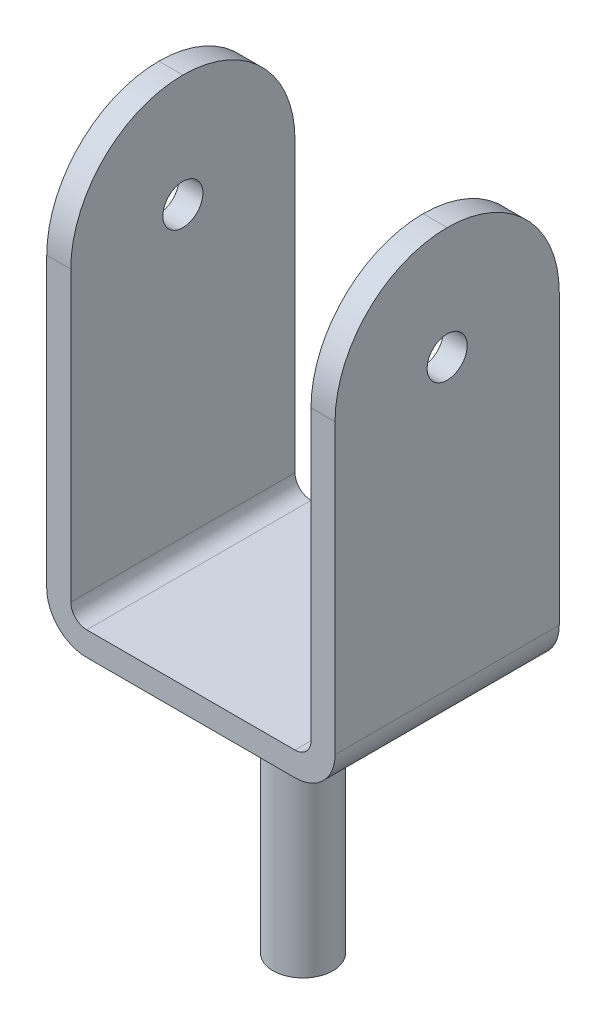
from build123d import *

# Parameters (mm, degrees)
BOSS_EXTRUDE1_DEPTH = 140
FILLET1_R           = 140
SKETCH2_R           = 25
CUT_EXTRUDE1_DEPTH  = 648.765389628
SKETCH3_R           = 37.5
BOSS_EXTRUDE2_DEPTH = 325
FILLET2_R           = 20
FILLET3_R           = 50


with BuildPart() as part:
    # Sketch1 → Boss-Extrude1 (new, symmetric)
    with BuildSketch(Plane.XY):
        Polygon((-150, 0), (150, 0), (150, 520), (180, 520), (180, -30), (-180, -30), (-180, 520), (-150, 520), align=None)
    extrude(amount=BOSS_EXTRUDE1_DEPTH, both=True)

    # Fillet1
    fillet1_edges = [part.edges().sort_by_distance(p)[0] for p in [
        (165, 520, 140),
        (165, 520, -140),
        (-165, 520, -140),
        (-165, 520, 140),
    ]]
    fillet(fillet1_edges, radius=FILLET1_R - 0.0001)  # a hair under: the kernel refuses the full size

    # Sketch2 → Cut-Extrude1 (cut, through all)
    with BuildSketch(Plane(origin=(180, 0, 0), x_dir=(0, 0, -1), z_dir=(1, 0, 0))):
        with Locations((0, 380)):
            Circle(SKETCH2_R)
    extrude(amount=-CUT_EXTRUDE1_DEPTH, mode=Mode.SUBTRACT)

    # Sketch3 → Boss-Extrude2 (add)
    with BuildSketch(Plane.XZ.offset(30)):
        with Locations(Location((0, 0, 0), (0, 0, 270))):
            Circle(SKETCH3_R)
    extrude(amount=BOSS_EXTRUDE2_DEPTH)

    # Fillet2
    fillet2_edges = [part.edges().sort_by_distance(p)[0] for p in [
        (-150, 0, 0),
        (150, 0, 0),
    ]]
    fillet(fillet2_edges, radius=FILLET2_R)

    # Fillet3
    fillet3_edges = [part.edges().sort_by_distance(p)[0] for p in [
        (180, -30, 0),
        (-180, -30, 0),
    ]]
    fillet(fillet3_edges, radius=FILLET3_R)


solid = part.part
